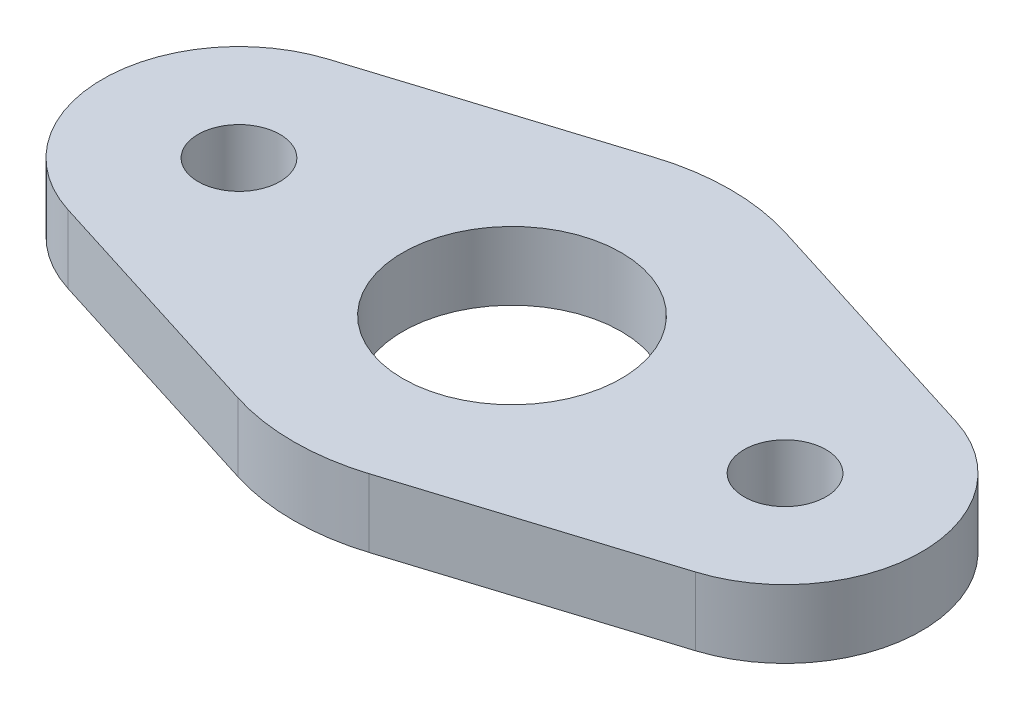
from build123d import *

# Parameters (mm, degrees)
SKETCH1_R           = 1.5
SKETCH1_R_2         = 4
BOSS_EXTRUDE1_DEPTH = 2.5


with BuildPart() as part:
    # Sketch1 → Boss-Extrude1 (new body)
    with BuildSketch(Plane(origin=(0, 0, 0), x_dir=(1, 0, 0), z_dir=(0, 1, 0))):
        with BuildLine():
            Line((-2.4, 7.631513611), (-11.5, 4.769696007))
            ThreePointArc((-11.5, 4.769696007), (-15, 0), (-11.5, -4.769696007))
            Line((-11.5, -4.769696007), (-2.4, -7.631513611))
            ThreePointArc((-2.4, -7.631513611), (0, -8), (2.4, -7.631513611))
            Line((2.4, -7.631513611), (11.5, -4.769696007))
            ThreePointArc((11.5, -4.769696007), (15, 0), (11.5, 4.769696007))
            Line((11.5, 4.769696007), (2.4, 7.631513611))
            ThreePointArc((2.4, 7.631513611), (0, 8), (-2.4, 7.631513611))
        make_face()
        with Locations((-10, 0)):
            Circle(SKETCH1_R, mode=Mode.SUBTRACT)
        with Locations((10, 0)):
            Circle(SKETCH1_R, mode=Mode.SUBTRACT)
        Circle(SKETCH1_R_2, mode=Mode.SUBTRACT)
    extrude(amount=BOSS_EXTRUDE1_DEPTH)


solid = part.part
